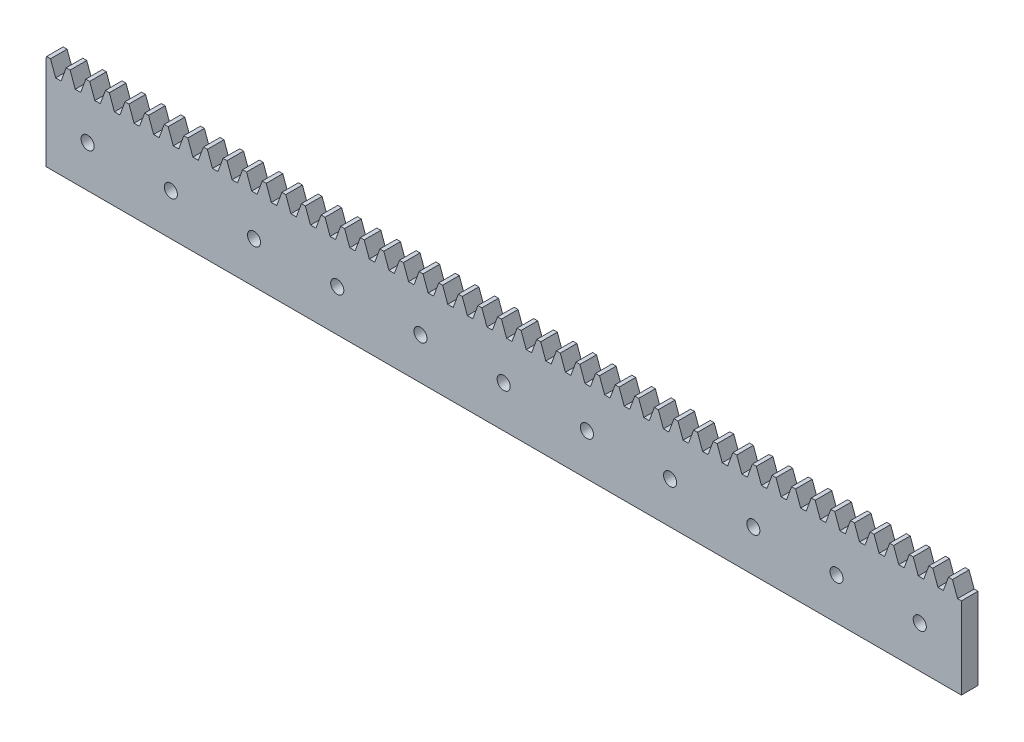
from build123d import *

# Parameters (mm, degrees)
BLANKSKE_W          = 660
BLANKSKE_H          = 23
BLANK_DEPTH         = 4
TOOTHCUTSIM_DEPTH   = 661.412749726
TEETHCUTS_COUNT     = 142
TEETHCUTS_PITCH     = 4.712388975
SKETCH_2_R          = 1.575
CUT_EXTRUDE_2_DEPTH = 661.412749726
SKETCH_3_W          = 440
SKETCH_3_H          = 84.823561565
CUT_EXTRUDE_3_DEPTH = 661.412749726


with BuildPart() as part:
    # BlankSke → Blank (new body)
    with BuildSketch(Plane.XY):
        with Locations((330, 11.5)):
            Rectangle(BLANKSKE_W, BLANKSKE_H)
    extrude(amount=-BLANK_DEPTH)

    # TooCutSkeSim → ToothCutSim (cut, through all)
    with BuildSketch(Plane.XY):
        Polygon((0.654653055, 19.625), (-0.654653055, 19.625), (-1.892297439, 23.0254), (1.892297439, 23.0254), align=None)
    toothcutsim = extrude(amount=-TOOTHCUTSIM_DEPTH, mode=Mode.SUBTRACT)

    # TeethCuts: ToothCutSim ×142
    with Locations(*[(i * TEETHCUTS_PITCH, 0, 0) for i in range(1, TEETHCUTS_COUNT)]):
        add(toothcutsim, mode=Mode.SUBTRACT)

    # 草图2 → 切除-拉伸2 (cut, through all)
    with BuildSketch(Plane.XY):
        with Locations((650, 10)):
            Circle(SKETCH_2_R)
        with Locations((630, 10)):
            Circle(SKETCH_2_R)
        with Locations((610, 10)):
            Circle(SKETCH_2_R)
        with Locations((590, 10)):
            Circle(SKETCH_2_R)
        with Locations((570, 10)):
            Circle(SKETCH_2_R)
        with Locations((550, 10)):
            Circle(SKETCH_2_R)
        with Locations((530, 10)):
            Circle(SKETCH_2_R)
        with Locations((510, 10)):
            Circle(SKETCH_2_R)
        with Locations((490, 10)):
            Circle(SKETCH_2_R)
        with Locations((470, 10)):
            Circle(SKETCH_2_R)
        with Locations((450, 10)):
            Circle(SKETCH_2_R)
        with Locations((430, 10)):
            Circle(SKETCH_2_R)
        with Locations((410, 10)):
            Circle(SKETCH_2_R)
        with Locations((390, 10)):
            Circle(SKETCH_2_R)
        with Locations((370, 10)):
            Circle(SKETCH_2_R)
        with Locations((350, 10)):
            Circle(SKETCH_2_R)
        with Locations((330, 10)):
            Circle(SKETCH_2_R)
        with Locations((310, 10)):
            Circle(SKETCH_2_R)
        with Locations((290, 10)):
            Circle(SKETCH_2_R)
        with Locations((270, 10)):
            Circle(SKETCH_2_R)
        with Locations((250, 10)):
            Circle(SKETCH_2_R)
        with Locations((230, 10)):
            Circle(SKETCH_2_R)
        with Locations((210, 10)):
            Circle(SKETCH_2_R)
        with Locations((190, 10)):
            Circle(SKETCH_2_R)
        with Locations((170, 10)):
            Circle(SKETCH_2_R)
        with Locations((150, 10)):
            Circle(SKETCH_2_R)
        with Locations((130, 10)):
            Circle(SKETCH_2_R)
        with Locations((110, 10)):
            Circle(SKETCH_2_R)
        with Locations((90, 10)):
            Circle(SKETCH_2_R)
        with Locations((70, 10)):
            Circle(SKETCH_2_R)
        with Locations((50, 10)):
            Circle(SKETCH_2_R)
        with Locations((30, 10)):
            Circle(SKETCH_2_R)
        with Locations((10, 10)):
            Circle(SKETCH_2_R)
    extrude(amount=-CUT_EXTRUDE_2_DEPTH, mode=Mode.SUBTRACT)

    # 草图3 → 切除-拉伸3 (cut, through all)
    with BuildSketch(Plane.XY):
        with Locations((220, 42.411780783)):
            Rectangle(SKETCH_3_W, SKETCH_3_H)
    extrude(amount=-CUT_EXTRUDE_3_DEPTH, mode=Mode.SUBTRACT)


solid = part.part
